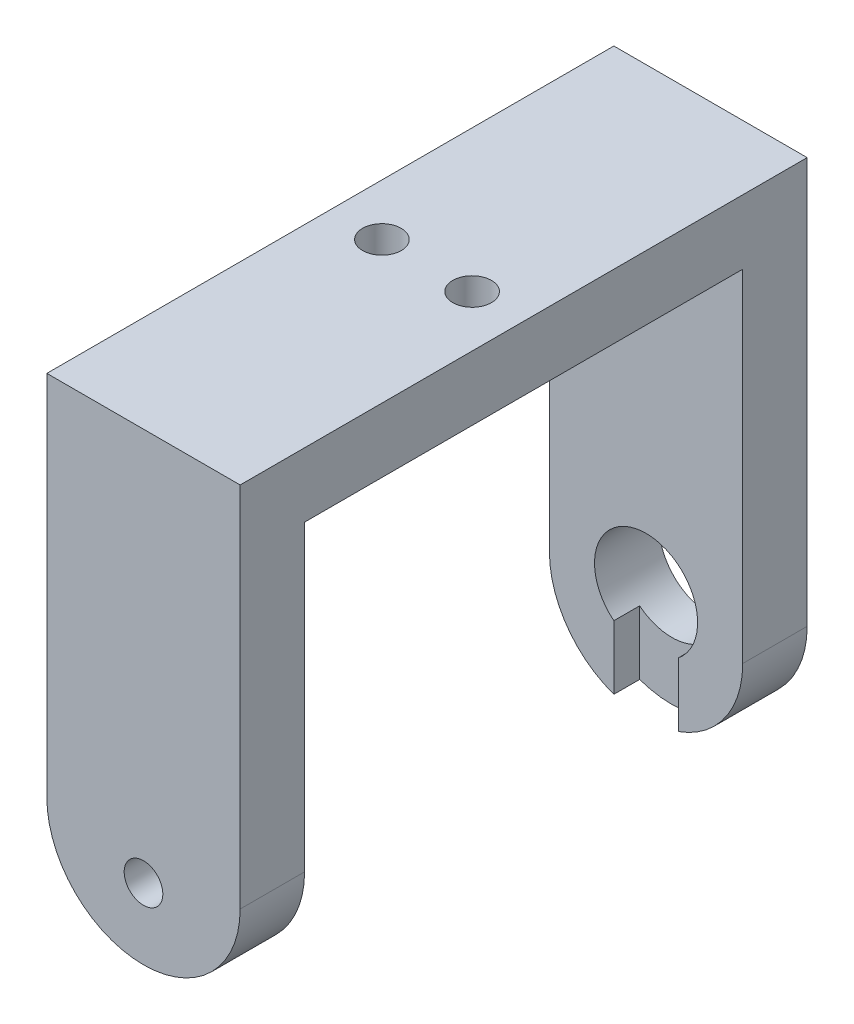
from build123d import *

# Parameters (mm, degrees)
CROQUIS1_W              = 15
CROQUIS1_H              = 44
CROQUIS1_R              = 1.5
SALIENTE_EXTRUIR1_DEPTH = 5
CROQUIS2_W              = 15
CROQUIS2_H              = 5
SALIENTE_EXTRUIR2_DEPTH = 34
CROQUIS2_3_W            = 15
CROQUIS2_3_H            = 5
SALIENTE_EXTRUIR3_DEPTH = 31
CORTAR_EXTRUIR1_REACH   = 61.273
CROQUIS3_R              = 1.5
CORTAR_EXTRUIR2_REACH   = 61.273
CROQUIS4_R              = 4
CROQUIS5_W              = 5
CROQUIS5_H              = 5.377501001
CORTAR_EXTRUIR3_DEPTH   = 2
CORTAR_EXTRUIR4_DEPTH   = 3


with BuildPart() as part:
    # Croquis1 → Saliente-Extruir1 (new body)
    with BuildSketch(Plane(origin=(0, 0, 0), x_dir=(1, 0, 0), z_dir=(0, 1, 0))):
        Rectangle(CROQUIS1_W, CROQUIS1_H)
        with Locations((3.5, 0)):
            Circle(CROQUIS1_R, mode=Mode.SUBTRACT)
        with Locations((-3.5, 0)):
            Circle(CROQUIS1_R, mode=Mode.SUBTRACT)
    extrude(amount=-SALIENTE_EXTRUIR1_DEPTH)

    # Croquis2 → Saliente-Extruir2 (add)
    with BuildSketch(Plane.XZ.offset(5)):
        with Locations((0, -19.5)):
            Rectangle(CROQUIS2_W, CROQUIS2_H)
    extrude(amount=SALIENTE_EXTRUIR2_DEPTH)

    # Croquis2<3> → Saliente-Extruir3 (add)
    with BuildSketch(Plane.XZ.offset(5)):
        with Locations((0, 19.5)):
            Rectangle(CROQUIS2_3_W, CROQUIS2_3_H)
    extrude(amount=SALIENTE_EXTRUIR3_DEPTH)

    # Croquis3 → Cortar-Extruir1 (cut, up to next)
    with BuildSketch(Plane.XY.offset(22), mode=Mode.PRIVATE) as cortar_extruir1_sk1:
        with BuildLine():
            ThreePointArc((0, -36), (-5.303300859, -33.803300859), (-7.5, -28.5))
            Line((-7.5, -28.5), (-7.5, -36))
            Line((-7.5, -36), (0, -36))
        make_face()
    cortar_extruir1_tool1 = extrude(cortar_extruir1_sk1.sketch, amount=-CORTAR_EXTRUIR1_REACH, mode=Mode.PRIVATE) & part.part
    # Croquis3 → Cortar-Extruir1 (cut, up to next)
    with BuildSketch(Plane.XY.offset(22), mode=Mode.PRIVATE) as cortar_extruir1_sk2:
        with BuildLine():
            Line((7.5, -36), (7.5, -28.5))
            ThreePointArc((7.5, -28.5), (5.303300859, -33.803300859), (0, -36))
            Line((0, -36), (7.5, -36))
        make_face()
    cortar_extruir1_tool2 = extrude(cortar_extruir1_sk2.sketch, amount=-CORTAR_EXTRUIR1_REACH, mode=Mode.PRIVATE) & part.part
    # Croquis3 → Cortar-Extruir1 (cut, up to next)
    with BuildSketch(Plane.XY.offset(22), mode=Mode.PRIVATE) as cortar_extruir1_sk3:
        with Locations((0, -30.5)):
            Circle(CROQUIS3_R)
    cortar_extruir1_tool3 = extrude(cortar_extruir1_sk3.sketch, amount=-CORTAR_EXTRUIR1_REACH, mode=Mode.PRIVATE) & part.part
    add(cortar_extruir1_tool1.solids().sort_by_distance((-5.82474, -34.32474, 22))[0], mode=Mode.SUBTRACT)
    add(cortar_extruir1_tool2.solids().sort_by_distance((5.82474, -34.32474, 22))[0], mode=Mode.SUBTRACT)
    add(cortar_extruir1_tool3.solids().sort_by_distance((0, -30.5, 22))[0], mode=Mode.SUBTRACT)

    # Croquis4 → Cortar-Extruir2 (cut, up to next)
    with BuildSketch(Plane(origin=(0, 0, -22), x_dir=(-1, 0, 0), z_dir=(0, 0, -1)), mode=Mode.PRIVATE) as cortar_extruir2_sk1:
        with Locations((0, -30.5)):
            Circle(CROQUIS4_R)
    cortar_extruir2_tool1 = extrude(cortar_extruir2_sk1.sketch, amount=-CORTAR_EXTRUIR2_REACH, mode=Mode.PRIVATE) & part.part
    # Croquis4 → Cortar-Extruir2 (cut, up to next)
    with BuildSketch(Plane(origin=(0, 0, -22), x_dir=(-1, 0, 0), z_dir=(0, 0, -1)), mode=Mode.PRIVATE) as cortar_extruir2_sk2:
        with BuildLine():
            Line((7.5, -39), (7.5, -31.5))
            ThreePointArc((7.5, -31.5), (5.303300859, -36.803300859), (0, -39))
            Line((0, -39), (7.5, -39))
        make_face()
    cortar_extruir2_tool2 = extrude(cortar_extruir2_sk2.sketch, amount=-CORTAR_EXTRUIR2_REACH, mode=Mode.PRIVATE) & part.part
    # Croquis4 → Cortar-Extruir2 (cut, up to next)
    with BuildSketch(Plane(origin=(0, 0, -22), x_dir=(-1, 0, 0), z_dir=(0, 0, -1)), mode=Mode.PRIVATE) as cortar_extruir2_sk3:
        with BuildLine():
            ThreePointArc((0, -39), (-5.303300862, -36.803300856), (-7.5, -31.499999991))
            Line((-7.5, -31.499999991), (-7.5, -39))
            Line((-7.5, -39), (0, -39))
        make_face()
    cortar_extruir2_tool3 = extrude(cortar_extruir2_sk3.sketch, amount=-CORTAR_EXTRUIR2_REACH, mode=Mode.PRIVATE) & part.part
    add(cortar_extruir2_tool1.solids().sort_by_distance((0, -30.5, -22))[0], mode=Mode.SUBTRACT)
    add(cortar_extruir2_tool2.solids().sort_by_distance((-5.82474, -37.32474, -22))[0], mode=Mode.SUBTRACT)
    add(cortar_extruir2_tool3.solids().sort_by_distance((5.82474, -37.32474, -22))[0], mode=Mode.SUBTRACT)

    # Croquis5 → Cortar-Extruir3 (cut)
    with BuildSketch(Plane.XY.offset(-17)):
        with Locations((0, -36.3112495)):
            Rectangle(CROQUIS5_W, CROQUIS5_H)
    extrude(amount=-CORTAR_EXTRUIR3_DEPTH, mode=Mode.SUBTRACT)

    # Croquis6 → Cortar-Extruir4 (cut)
    with BuildSketch(Plane(origin=(0, 0, -22), x_dir=(-1, 0, 0), z_dir=(0, 0, -1))):
        with BuildLine():
            Line((2.125, -10.5), (-2.125, -10.5))
            Line((-2.125, -10.5), (-3.464101615, -28.5))
            ThreePointArc((-3.464101615, -28.5), (0, -26.5), (3.464101615, -28.5))
            Line((3.464101615, -28.5), (2.125, -10.5))
        make_face()
    extrude(amount=-CORTAR_EXTRUIR4_DEPTH, mode=Mode.SUBTRACT)


solid = part.part
